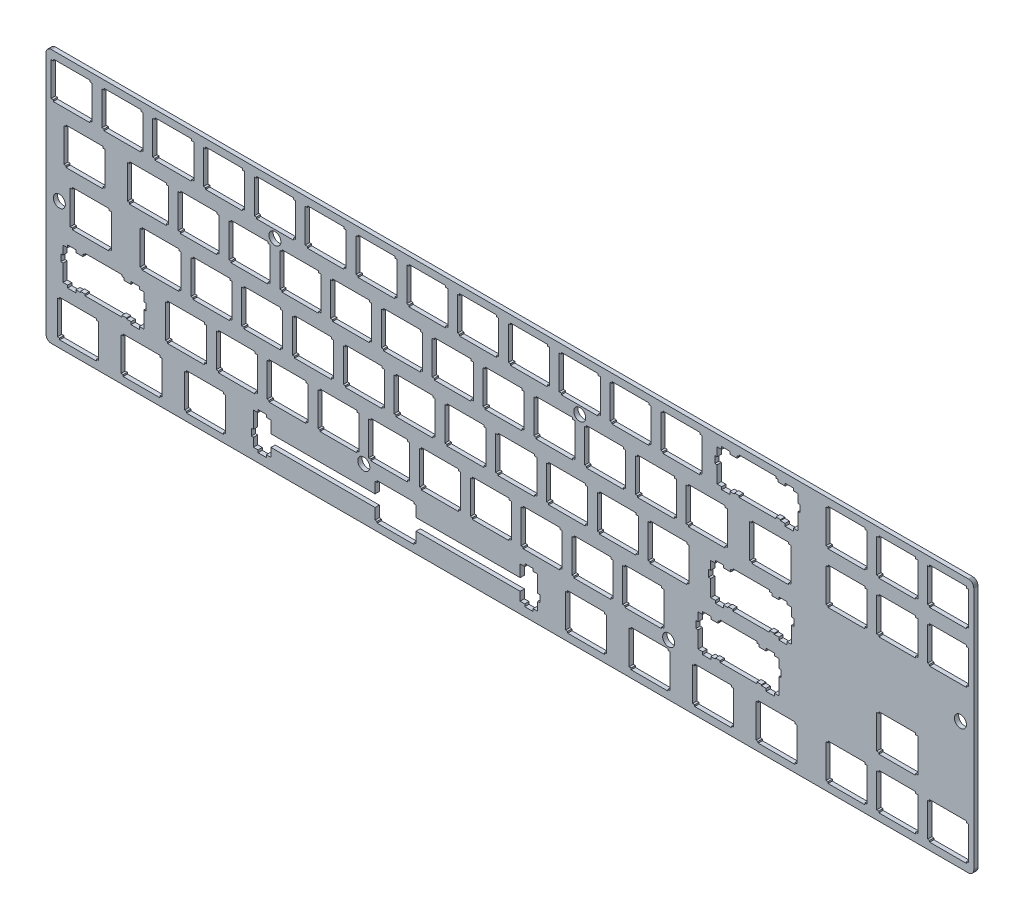
from build123d import *

# Parameters (mm, degrees)
MODEL_R             = 2.25
BOSS_EXTRUDE1_DEPTH = 1.5875


with BuildPart() as part:
    # Model → Boss-Extrude1 (new body)
    with BuildSketch(Plane.XY):
        Polygon((370.515556908, 199.863340857), (370.672556908, 199.856640857), (370.829556908, 199.838640857), (370.982556908, 199.808340857), (371.134556908, 199.765640857), (371.281556908, 199.710640857), (371.423556908, 199.645640857), (371.561556908, 199.568740857), (371.692556908, 199.481640857), (371.815556908, 199.383940857), (371.930556908, 199.277740857), (372.036556908, 199.162040857), (372.134556908, 199.039640857), (372.221556908, 198.908340857), (372.298556908, 198.770840857), (372.363556908, 198.628640857), (372.418556908, 198.482540857), (372.461556908, 198.329840857), (372.491556908, 198.176740857), (372.509556908, 198.019740857), (372.516556908, 197.862740857), (372.516556908, 106.413230857), (372.509556908, 106.256130857), (372.491556908, 106.100410857), (372.461556908, 105.946070857), (372.418556908, 105.794490857), (372.363556908, 105.647040857), (372.298556908, 105.505100857), (372.221556908, 105.368670857), (372.134556908, 105.237760857), (372.036556908, 105.113740857), (371.930556908, 104.997983857), (371.815556908, 104.891874857), (371.692556908, 104.794035857), (371.561556908, 104.707216857), (371.423556908, 104.630046857), (371.281556908, 104.565280857), (371.134556908, 104.510158857), (370.982556908, 104.467440857), (370.829556908, 104.437122857), (370.672556908, 104.419208857), (370.515556908, 104.413695857), (26.653556908, 104.413695857), (26.496456908, 104.419208857), (26.339356908, 104.437122857), (26.186396908, 104.467440857), (26.033436908, 104.510158857), (25.887366908, 104.565280857), (25.745426908, 104.630046857), (25.607616908, 104.707216857), (25.476708908, 104.794035857), (25.354061908, 104.891874857), (25.238308908, 104.997983857), (25.132199908, 105.113740857), (25.034356908, 105.237760857), (24.947541908, 105.368670857), (24.870371908, 105.505100857), (24.805603908, 105.647040857), (24.750481908, 105.794490857), (24.707762908, 105.946070857), (24.677445908, 106.100410857), (24.659531908, 106.256130857), (24.652641508, 106.411850857), (24.652641508, 197.862740857), (24.659531908, 198.019740857), (24.677445908, 198.176740857), (24.707762908, 198.329840857), (24.750481908, 198.482540857), (24.805603908, 198.628640857), (24.870371908, 198.770840857), (24.947541908, 198.908340857), (25.034356908, 199.039640857), (25.132199908, 199.162040857), (25.238308908, 199.277740857), (25.354061908, 199.383940857), (25.476708908, 199.481640857), (25.607616908, 199.568740857), (25.745426908, 199.645640857), (25.887366908, 199.710640857), (26.033436908, 199.765640857), (26.186396908, 199.808340857), (26.339356908, 199.838640857), (26.496456908, 199.856640857), (26.653556908, 199.863340857), align=None)
        with Locations((143.815056908, 123.864140857)):
            Circle(MODEL_R, mode=Mode.SUBTRACT)
        with Locations((110.477456908, 180.414140857)):
            Circle(MODEL_R, mode=Mode.SUBTRACT)
        with Locations((224.778056908, 180.414140857)):
            Circle(MODEL_R, mode=Mode.SUBTRACT)
        with Locations((258.115056908, 123.864140857)):
            Circle(MODEL_R, mode=Mode.SUBTRACT)
        Polygon((162.620556908, 107.138080857), (162.620556908, 107.737580857), (163.419556908, 107.737580857), (163.419556908, 111.838580857), (202.445456908, 111.838580857), (202.445456908, 108.608480857), (204.169556908, 108.608480857), (204.169556908, 107.689280857), (207.270056908, 107.689280857), (207.270056908, 108.608480857), (208.995556908, 108.608480857), (208.995556908, 111.838580857), (209.819556908, 111.838580857), (209.819556908, 114.438940857), (208.995556908, 114.438940857), (208.995556908, 120.707630857), (207.270056908, 120.707630857), (207.270056908, 121.688800857), (204.169556908, 121.688800857), (204.169556908, 120.707630857), (202.445456908, 120.707630857), (202.445456908, 116.238670857), (163.419556908, 116.238670857), (163.419556908, 120.338330857), (162.620556908, 120.338330857), (162.620556908, 120.939140857), (148.820556908, 120.939140857), (148.820556908, 120.338330857), (148.019556908, 120.338330857), (148.019556908, 116.238670857), (108.995556908, 116.238670857), (108.995556908, 120.707630857), (107.269556908, 120.707630857), (107.269556908, 121.688800857), (104.169556908, 121.688800857), (104.169556908, 120.707630857), (102.445556908, 120.707630857), (102.445556908, 114.438940857), (101.620556908, 114.438940857), (101.620556908, 111.838580857), (102.445556908, 111.838580857), (102.445556908, 108.608480857), (104.169556908, 108.608480857), (104.169556908, 107.689280857), (107.269556908, 107.689280857), (107.269556908, 108.608480857), (108.995556908, 108.608480857), (108.995556908, 111.838580857), (148.019556908, 111.838580857), (148.019556908, 107.737580857), (148.820556908, 107.737580857), (148.820556908, 107.138080857), align=None, mode=Mode.SUBTRACT)
        Polygon((355.989556908, 120.939140857), (355.989556908, 120.339640857), (355.190556908, 120.339640857), (355.190556908, 107.738890857), (355.989556908, 107.738890857), (355.989556908, 107.138080857), (369.790556908, 107.138080857), (369.790556908, 107.738890857), (370.589556908, 107.738890857), (370.589556908, 120.339640857), (369.790556908, 120.339640857), (369.790556908, 120.939140857), align=None, mode=Mode.SUBTRACT)
        Polygon((336.939556908, 120.939140857), (336.939556908, 120.339640857), (336.140556908, 120.339640857), (336.140556908, 107.738890857), (336.939556908, 107.738890857), (336.939556908, 107.138080857), (350.740556908, 107.138080857), (350.740556908, 107.738890857), (351.539556908, 107.738890857), (351.539556908, 120.339640857), (350.740556908, 120.339640857), (350.740556908, 120.939140857), align=None, mode=Mode.SUBTRACT)
        Polygon((317.889556908, 120.939140857), (317.889556908, 120.339640857), (317.090556908, 120.339640857), (317.090556908, 107.738890857), (317.889556908, 107.738890857), (317.889556908, 107.138080857), (331.690556908, 107.138080857), (331.690556908, 107.738890857), (332.489556908, 107.738890857), (332.489556908, 120.339640857), (331.690556908, 120.339640857), (331.690556908, 120.939140857), align=None, mode=Mode.SUBTRACT)
        Polygon((291.695556908, 120.939140857), (291.695556908, 120.339640857), (290.896556908, 120.339640857), (290.896556908, 107.738890857), (291.695556908, 107.738890857), (291.695556908, 107.138080857), (305.495556908, 107.138080857), (305.495556908, 107.738890857), (306.296556908, 107.738890857), (306.296556908, 120.339640857), (305.495556908, 120.339640857), (305.495556908, 120.939140857), align=None, mode=Mode.SUBTRACT)
        Polygon((267.884556908, 120.939140857), (267.884556908, 120.339640857), (267.084556908, 120.339640857), (267.084556908, 107.738890857), (267.884556908, 107.738890857), (267.884556908, 107.138080857), (281.684556908, 107.138080857), (281.684556908, 107.738890857), (282.483556908, 107.738890857), (282.483556908, 120.339640857), (281.684556908, 120.339640857), (281.684556908, 120.939140857), align=None, mode=Mode.SUBTRACT)
        Polygon((244.070556908, 120.939140857), (244.070556908, 120.339640857), (243.271556908, 120.339640857), (243.271556908, 107.738890857), (244.070556908, 107.738890857), (244.070556908, 107.138080857), (257.870556908, 107.138080857), (257.870556908, 107.738890857), (258.671556908, 107.738890857), (258.671556908, 120.339640857), (257.870556908, 120.339640857), (257.870556908, 120.939140857), align=None, mode=Mode.SUBTRACT)
        Polygon((220.259556908, 120.939140857), (220.259556908, 120.339640857), (219.459556908, 120.339640857), (219.459556908, 107.738890857), (220.259556908, 107.738890857), (220.259556908, 107.138080857), (234.059556908, 107.138080857), (234.059556908, 107.738890857), (234.858556908, 107.738890857), (234.858556908, 120.339640857), (234.059556908, 120.339640857), (234.059556908, 120.939140857), align=None, mode=Mode.SUBTRACT)
        Polygon((77.384656908, 120.939140857), (77.384656908, 120.339640857), (76.584156908, 120.339640857), (76.584156908, 107.738890857), (77.384656908, 107.738890857), (77.384656908, 107.138080857), (91.184256908, 107.138080857), (91.184256908, 107.738890857), (91.983656908, 107.738890857), (91.983656908, 120.339640857), (91.184256908, 120.339640857), (91.184256908, 120.939140857), align=None, mode=Mode.SUBTRACT)
        Polygon((53.570756908, 120.939140857), (53.570756908, 120.339640857), (52.771556908, 120.339640857), (52.771556908, 107.738890857), (53.570756908, 107.738890857), (53.570756908, 107.138080857), (67.370356908, 107.138080857), (67.370356908, 107.738890857), (68.171156908, 107.738890857), (68.171156908, 120.339640857), (67.370356908, 120.339640857), (67.370356908, 120.939140857), align=None, mode=Mode.SUBTRACT)
        Polygon((29.759656908, 120.939140857), (29.759656908, 120.339640857), (28.959026908, 120.339640857), (28.959026908, 107.738890857), (29.759656908, 107.738890857), (29.759656908, 107.138080857), (43.559356908, 107.138080857), (43.559356908, 107.738890857), (44.358556908, 107.738890857), (44.358556908, 120.339640857), (43.559356908, 120.339640857), (43.559356908, 120.939140857), align=None, mode=Mode.SUBTRACT)
        Polygon((277.408556908, 139.990640857), (277.408556908, 139.389840857), (276.609556908, 139.389840857), (276.609556908, 138.518740857), (275.684556908, 138.518740857), (273.959556908, 138.518740857), (273.959556908, 139.437840857), (270.858556908, 139.437840857), (270.858556908, 138.518740857), (269.134556908, 138.518740857), (269.134556908, 135.288640857), (268.308556908, 135.288640857), (268.308556908, 132.688240857), (269.134556908, 132.688240857), (269.134556908, 126.418240857), (270.858556908, 126.418240857), (270.858556908, 125.438440857), (273.959556908, 125.438440857), (273.959556908, 126.418240857), (275.684556908, 126.418240857), (275.684556908, 126.788840857), (276.609556908, 126.788840857), (277.408556908, 126.788840857), (277.408556908, 126.188040857), (291.209556908, 126.188040857), (291.209556908, 126.788840857), (292.008556908, 126.788840857), (292.934556908, 126.788840857), (292.934556908, 126.418240857), (294.658556908, 126.418240857), (294.658556908, 125.438440857), (297.759556908, 125.438440857), (297.759556908, 126.418240857), (299.484556908, 126.418240857), (299.484556908, 132.688240857), (300.308556908, 132.688240857), (300.308556908, 135.288640857), (299.484556908, 135.288640857), (299.484556908, 138.518740857), (297.759556908, 138.518740857), (297.759556908, 139.437840857), (294.658556908, 139.437840857), (294.658556908, 138.518740857), (292.934556908, 138.518740857), (292.008556908, 138.518740857), (292.008556908, 139.389840857), (291.209556908, 139.389840857), (291.209556908, 139.990640857), align=None, mode=Mode.SUBTRACT)
        Polygon((39.284656908, 139.990640857), (39.284656908, 139.389840857), (38.484056908, 139.389840857), (38.484056908, 138.518740857), (37.559356908, 138.518740857), (35.834056908, 138.518740857), (35.834056908, 139.437840857), (32.733466908, 139.437840857), (32.733466908, 138.518740857), (31.009546908, 138.518740857), (31.009546908, 135.288640857), (30.184076908, 135.288640857), (30.184076908, 132.688240857), (31.009546908, 132.688240857), (31.009546908, 126.418240857), (32.733466908, 126.418240857), (32.733466908, 125.438440857), (35.834056908, 125.438440857), (35.834056908, 126.418240857), (37.559356908, 126.418240857), (37.559356908, 126.788840857), (38.484056908, 126.788840857), (39.284656908, 126.788840857), (39.284656908, 126.188040857), (53.084356908, 126.188040857), (53.084356908, 126.788840857), (53.883556908, 126.788840857), (54.809656908, 126.788840857), (54.809656908, 126.418240857), (56.533556908, 126.418240857), (56.533556908, 125.438440857), (59.634156908, 125.438440857), (59.634156908, 126.418240857), (61.359356908, 126.418240857), (61.359356908, 132.688240857), (62.183456908, 132.688240857), (62.183456908, 135.288640857), (61.359356908, 135.288640857), (61.359356908, 138.518740857), (59.634156908, 138.518740857), (59.634156908, 139.437840857), (56.533556908, 139.437840857), (56.533556908, 138.518740857), (54.809656908, 138.518740857), (53.883556908, 138.518740857), (53.883556908, 139.389840857), (53.084356908, 139.389840857), (53.084356908, 139.990640857), align=None, mode=Mode.SUBTRACT)
        Polygon((299.153556908, 195.668840857), (300.078556908, 195.668840857), (301.803556908, 195.668840857), (301.803556908, 196.589240857), (304.902556908, 196.589240857), (304.902556908, 195.668840857), (306.628556908, 195.668840857), (306.628556908, 192.438740857), (307.453556908, 192.438740857), (307.453556908, 189.838440857), (306.628556908, 189.838440857), (306.628556908, 183.568140857), (304.902556908, 183.568140857), (304.902556908, 182.588540857), (301.803556908, 182.588540857), (301.803556908, 183.568140857), (300.078556908, 183.568140857), (300.078556908, 183.937540857), (299.153556908, 183.937540857), (298.352556908, 183.937540857), (298.352556908, 183.338140857), (284.553556908, 183.338140857), (284.553556908, 183.937540857), (283.752556908, 183.937540857), (282.827556908, 183.937540857), (282.827556908, 183.568140857), (281.102556908, 183.568140857), (281.102556908, 182.588540857), (278.003556908, 182.588540857), (278.003556908, 183.568140857), (276.278556908, 183.568140857), (276.278556908, 189.838440857), (275.452556908, 189.838440857), (275.452556908, 192.438740857), (276.278556908, 192.438740857), (276.278556908, 195.668840857), (278.003556908, 195.668840857), (278.003556908, 196.589240857), (281.102556908, 196.589240857), (281.102556908, 195.668840857), (282.827556908, 195.668840857), (283.752556908, 195.668840857), (283.752556908, 196.538440857), (284.553556908, 196.538440857), (284.553556908, 197.137740857), (298.352556908, 197.137740857), (298.352556908, 196.538440857), (299.153556908, 196.538440857), align=None, mode=Mode.SUBTRACT)
        Polygon((296.771556908, 157.568840857), (297.695556908, 157.568840857), (299.421556908, 157.568840857), (299.421556908, 158.489240857), (302.521556908, 158.489240857), (302.521556908, 157.568840857), (304.245556908, 157.568840857), (304.245556908, 154.338740857), (305.070556908, 154.338740857), (305.070556908, 151.739540857), (304.245556908, 151.739540857), (304.245556908, 145.469640857), (302.521556908, 145.469640857), (302.521556908, 144.488540857), (299.421556908, 144.488540857), (299.421556908, 145.469640857), (297.695556908, 145.469640857), (297.695556908, 145.838940857), (296.771556908, 145.838940857), (295.970556908, 145.838940857), (295.970556908, 145.239540857), (282.170556908, 145.239540857), (282.170556908, 145.838940857), (281.371556908, 145.838940857), (280.445556908, 145.838940857), (280.445556908, 145.469640857), (278.720556908, 145.469640857), (278.720556908, 144.488540857), (275.620556908, 144.488540857), (275.620556908, 145.469640857), (273.895556908, 145.469640857), (273.895556908, 151.739540857), (273.071556908, 151.739540857), (273.071556908, 154.338740857), (273.895556908, 154.338740857), (273.895556908, 157.568840857), (275.620556908, 157.568840857), (275.620556908, 158.489240857), (278.720556908, 158.489240857), (278.720556908, 157.568840857), (280.445556908, 157.568840857), (281.371556908, 157.568840857), (281.371556908, 158.438440857), (282.170556908, 158.438440857), (282.170556908, 159.039240857), (295.970556908, 159.039240857), (295.970556908, 158.438440857), (296.771556908, 158.438440857), align=None, mode=Mode.SUBTRACT)
        Polygon((336.939556908, 139.990640857), (336.939556908, 139.389840857), (336.140556908, 139.389840857), (336.140556908, 126.788840857), (336.939556908, 126.788840857), (336.939556908, 126.188040857), (350.740556908, 126.188040857), (350.740556908, 126.788840857), (351.539556908, 126.788840857), (351.539556908, 139.389840857), (350.740556908, 139.389840857), (350.740556908, 139.990640857), align=None, mode=Mode.SUBTRACT)
        Polygon((241.689556908, 139.990640857), (241.689556908, 139.389840857), (240.890556908, 139.389840857), (240.890556908, 126.788840857), (241.689556908, 126.788840857), (241.689556908, 126.188040857), (255.490556908, 126.188040857), (255.490556908, 126.788840857), (256.289556908, 126.788840857), (256.289556908, 139.389840857), (255.490556908, 139.389840857), (255.490556908, 139.990640857), align=None, mode=Mode.SUBTRACT)
        Polygon((222.639556908, 139.990640857), (222.639556908, 139.389840857), (221.840556908, 139.389840857), (221.840556908, 126.788840857), (222.639556908, 126.788840857), (222.639556908, 126.188040857), (236.440556908, 126.188040857), (236.440556908, 126.788840857), (237.239556908, 126.788840857), (237.239556908, 139.389840857), (236.440556908, 139.389840857), (236.440556908, 139.990640857), align=None, mode=Mode.SUBTRACT)
        Polygon((203.589556908, 139.990640857), (203.589556908, 139.389840857), (202.790556908, 139.389840857), (202.790556908, 126.788840857), (203.589556908, 126.788840857), (203.589556908, 126.188040857), (217.390556908, 126.188040857), (217.390556908, 126.788840857), (218.189556908, 126.788840857), (218.189556908, 139.389840857), (217.390556908, 139.389840857), (217.390556908, 139.990640857), align=None, mode=Mode.SUBTRACT)
        Polygon((184.539556908, 139.990640857), (184.539556908, 139.389840857), (183.740556908, 139.389840857), (183.740556908, 126.788840857), (184.539556908, 126.788840857), (184.539556908, 126.188040857), (198.340556908, 126.188040857), (198.340556908, 126.788840857), (199.139556908, 126.788840857), (199.139556908, 139.389840857), (198.340556908, 139.389840857), (198.340556908, 139.990640857), align=None, mode=Mode.SUBTRACT)
        Polygon((165.489556908, 139.990640857), (165.489556908, 139.389840857), (164.690556908, 139.389840857), (164.690556908, 126.788840857), (165.489556908, 126.788840857), (165.489556908, 126.188040857), (179.290556908, 126.188040857), (179.290556908, 126.788840857), (180.089556908, 126.788840857), (180.089556908, 139.389840857), (179.290556908, 139.389840857), (179.290556908, 139.990640857), align=None, mode=Mode.SUBTRACT)
        Polygon((146.439556908, 139.990640857), (146.439556908, 139.389840857), (145.640556908, 139.389840857), (145.640556908, 126.788840857), (146.439556908, 126.788840857), (146.439556908, 126.188040857), (160.240556908, 126.188040857), (160.240556908, 126.788840857), (161.039556908, 126.788840857), (161.039556908, 139.389840857), (160.240556908, 139.389840857), (160.240556908, 139.990640857), align=None, mode=Mode.SUBTRACT)
        Polygon((127.389556908, 139.990640857), (127.389556908, 139.389840857), (126.590556908, 139.389840857), (126.590556908, 126.788840857), (127.389556908, 126.788840857), (127.389556908, 126.188040857), (141.190556908, 126.188040857), (141.190556908, 126.788840857), (141.989556908, 126.788840857), (141.989556908, 139.389840857), (141.190556908, 139.389840857), (141.190556908, 139.990640857), align=None, mode=Mode.SUBTRACT)
        Polygon((108.339456908, 139.990640857), (108.339456908, 139.389840857), (107.540456908, 139.389840857), (107.540456908, 126.788840857), (108.339456908, 126.788840857), (108.339456908, 126.188040857), (122.140456908, 126.188040857), (122.140456908, 126.788840857), (122.939856908, 126.788840857), (122.939856908, 139.389840857), (122.140456908, 139.389840857), (122.140456908, 139.990640857), align=None, mode=Mode.SUBTRACT)
        Polygon((89.289456908, 139.990640857), (89.289456908, 139.389840857), (88.490456908, 139.389840857), (88.490456908, 126.788840857), (89.289456908, 126.788840857), (89.289456908, 126.188040857), (103.090456908, 126.188040857), (103.090456908, 126.788840857), (103.889856908, 126.788840857), (103.889856908, 139.389840857), (103.090456908, 139.389840857), (103.090456908, 139.990640857), align=None, mode=Mode.SUBTRACT)
        Polygon((70.239456908, 139.990640857), (70.239456908, 139.389840857), (69.440456908, 139.389840857), (69.440456908, 126.788840857), (70.239456908, 126.788840857), (70.239456908, 126.188040857), (84.040456908, 126.188040857), (84.040456908, 126.788840857), (84.839856908, 126.788840857), (84.839856908, 139.389840857), (84.040456908, 139.389840857), (84.040456908, 139.990640857), align=None, mode=Mode.SUBTRACT)
        Polygon((251.214556908, 159.039240857), (251.214556908, 158.438440857), (250.415556908, 158.438440857), (250.415556908, 145.838940857), (251.214556908, 145.838940857), (251.214556908, 145.239540857), (265.015556908, 145.239540857), (265.015556908, 145.838940857), (265.814556908, 145.838940857), (265.814556908, 158.438440857), (265.015556908, 158.438440857), (265.015556908, 159.039240857), align=None, mode=Mode.SUBTRACT)
        Polygon((232.164556908, 159.039240857), (232.164556908, 158.438440857), (231.365556908, 158.438440857), (231.365556908, 145.838940857), (232.164556908, 145.838940857), (232.164556908, 145.239540857), (245.965556908, 145.239540857), (245.965556908, 145.838940857), (246.764556908, 145.838940857), (246.764556908, 158.438440857), (245.965556908, 158.438440857), (245.965556908, 159.039240857), align=None, mode=Mode.SUBTRACT)
        Polygon((213.114556908, 159.039240857), (213.114556908, 158.438440857), (212.315556908, 158.438440857), (212.315556908, 145.838940857), (213.114556908, 145.838940857), (213.114556908, 145.239540857), (226.915556908, 145.239540857), (226.915556908, 145.838940857), (227.714556908, 145.838940857), (227.714556908, 158.438440857), (226.915556908, 158.438440857), (226.915556908, 159.039240857), align=None, mode=Mode.SUBTRACT)
        Polygon((194.064556908, 159.039240857), (194.064556908, 158.438440857), (193.265556908, 158.438440857), (193.265556908, 145.838940857), (194.064556908, 145.838940857), (194.064556908, 145.239540857), (207.865556908, 145.239540857), (207.865556908, 145.838940857), (208.664556908, 145.838940857), (208.664556908, 158.438440857), (207.865556908, 158.438440857), (207.865556908, 159.039240857), align=None, mode=Mode.SUBTRACT)
        Polygon((175.014556908, 159.039240857), (175.014556908, 158.438440857), (174.215556908, 158.438440857), (174.215556908, 145.838940857), (175.014556908, 145.838940857), (175.014556908, 145.239540857), (188.815556908, 145.239540857), (188.815556908, 145.838940857), (189.614556908, 145.838940857), (189.614556908, 158.438440857), (188.815556908, 158.438440857), (188.815556908, 159.039240857), align=None, mode=Mode.SUBTRACT)
        Polygon((155.964556908, 159.039240857), (155.964556908, 158.438440857), (155.165556908, 158.438440857), (155.165556908, 145.838940857), (155.964556908, 145.838940857), (155.964556908, 145.239540857), (169.765556908, 145.239540857), (169.765556908, 145.838940857), (170.564556908, 145.838940857), (170.564556908, 158.438440857), (169.765556908, 158.438440857), (169.765556908, 159.039240857), align=None, mode=Mode.SUBTRACT)
        Polygon((136.914556908, 159.039240857), (136.914556908, 158.438440857), (136.115556908, 158.438440857), (136.115556908, 145.838940857), (136.914556908, 145.838940857), (136.914556908, 145.239540857), (150.715556908, 145.239540857), (150.715556908, 145.838940857), (151.514556908, 145.838940857), (151.514556908, 158.438440857), (150.715556908, 158.438440857), (150.715556908, 159.039240857), align=None, mode=Mode.SUBTRACT)
        Polygon((117.864456908, 159.039240857), (117.864456908, 158.438440857), (117.065456908, 158.438440857), (117.065456908, 145.838940857), (117.864456908, 145.838940857), (117.864456908, 145.239540857), (131.665556908, 145.239540857), (131.665556908, 145.838940857), (132.464556908, 145.838940857), (132.464556908, 158.438440857), (131.665556908, 158.438440857), (131.665556908, 159.039240857), align=None, mode=Mode.SUBTRACT)
        Polygon((98.814456908, 159.039240857), (98.814456908, 158.438440857), (98.015456908, 158.438440857), (98.015456908, 145.838940857), (98.814456908, 145.838940857), (98.814456908, 145.239540857), (112.615456908, 145.239540857), (112.615456908, 145.838940857), (113.414856908, 145.838940857), (113.414856908, 158.438440857), (112.615456908, 158.438440857), (112.615456908, 159.039240857), align=None, mode=Mode.SUBTRACT)
        Polygon((79.764456908, 159.039240857), (79.764456908, 158.438440857), (78.965456908, 158.438440857), (78.965456908, 145.838940857), (79.764456908, 145.838940857), (79.764456908, 145.239540857), (93.565456908, 145.239540857), (93.565456908, 145.838940857), (94.364856908, 145.838940857), (94.364856908, 158.438440857), (93.565456908, 158.438440857), (93.565456908, 159.039240857), align=None, mode=Mode.SUBTRACT)
        Polygon((60.714456908, 159.039240857), (60.714456908, 158.438440857), (59.915456908, 158.438440857), (59.915456908, 145.838940857), (60.714456908, 145.838940857), (60.714456908, 145.239540857), (74.515456908, 145.239540857), (74.515456908, 145.838940857), (75.314856908, 145.838940857), (75.314856908, 158.438440857), (74.515456908, 158.438440857), (74.515456908, 159.039240857), align=None, mode=Mode.SUBTRACT)
        Polygon((34.520776908, 159.039240857), (34.520776908, 158.438440857), (33.721526908, 158.438440857), (33.721526908, 145.838940857), (34.520776908, 145.838940857), (34.520776908, 145.239540857), (48.320456908, 145.239540857), (48.320456908, 145.838940857), (49.121056908, 145.838940857), (49.121056908, 158.438440857), (48.320456908, 158.438440857), (48.320456908, 159.039240857), align=None, mode=Mode.SUBTRACT)
        Polygon((355.989556908, 178.087740857), (355.989556908, 177.489840857), (355.190556908, 177.489840857), (355.190556908, 164.888940857), (355.989556908, 164.888940857), (355.989556908, 164.289540857), (369.790556908, 164.289540857), (369.790556908, 164.888940857), (370.589556908, 164.888940857), (370.589556908, 177.489840857), (369.790556908, 177.489840857), (369.790556908, 178.087740857), align=None, mode=Mode.SUBTRACT)
        Polygon((336.939556908, 178.087740857), (336.939556908, 177.489840857), (336.140556908, 177.489840857), (336.140556908, 164.888940857), (336.939556908, 164.888940857), (336.939556908, 164.289540857), (350.740556908, 164.289540857), (350.740556908, 164.888940857), (351.539556908, 164.888940857), (351.539556908, 177.489840857), (350.740556908, 177.489840857), (350.740556908, 178.087740857), align=None, mode=Mode.SUBTRACT)
        Polygon((317.889556908, 178.087740857), (317.889556908, 177.489840857), (317.090556908, 177.489840857), (317.090556908, 164.888940857), (317.889556908, 164.888940857), (317.889556908, 164.289540857), (331.690556908, 164.289540857), (331.690556908, 164.888940857), (332.489556908, 164.888940857), (332.489556908, 177.489840857), (331.690556908, 177.489840857), (331.690556908, 178.087740857), align=None, mode=Mode.SUBTRACT)
        Polygon((289.314556908, 178.087740857), (289.314556908, 177.489840857), (288.515556908, 177.489840857), (288.515556908, 164.888940857), (289.314556908, 164.888940857), (289.314556908, 164.289540857), (303.115556908, 164.289540857), (303.115556908, 164.888940857), (303.914556908, 164.888940857), (303.914556908, 177.489840857), (303.115556908, 177.489840857), (303.115556908, 178.087740857), align=None, mode=Mode.SUBTRACT)
        Polygon((265.503556908, 178.087740857), (265.503556908, 177.489840857), (264.702556908, 177.489840857), (264.702556908, 164.888940857), (265.503556908, 164.888940857), (265.503556908, 164.289540857), (279.301556908, 164.289540857), (279.301556908, 164.888940857), (280.103556908, 164.888940857), (280.103556908, 177.489840857), (279.301556908, 177.489840857), (279.301556908, 178.087740857), align=None, mode=Mode.SUBTRACT)
        Polygon((246.453556908, 178.087740857), (246.453556908, 177.489840857), (245.652556908, 177.489840857), (245.652556908, 164.888940857), (246.453556908, 164.888940857), (246.453556908, 164.289540857), (260.252556908, 164.289540857), (260.252556908, 164.888940857), (261.053556908, 164.888940857), (261.053556908, 177.489840857), (260.252556908, 177.489840857), (260.252556908, 178.087740857), align=None, mode=Mode.SUBTRACT)
        Polygon((227.403556908, 178.087740857), (227.403556908, 177.489840857), (226.602556908, 177.489840857), (226.602556908, 164.888940857), (227.403556908, 164.888940857), (227.403556908, 164.289540857), (241.202556908, 164.289540857), (241.202556908, 164.888940857), (242.003556908, 164.888940857), (242.003556908, 177.489840857), (241.202556908, 177.489840857), (241.202556908, 178.087740857), align=None, mode=Mode.SUBTRACT)
        Polygon((208.353556908, 178.087740857), (208.353556908, 177.489840857), (207.552556908, 177.489840857), (207.552556908, 164.888940857), (208.353556908, 164.888940857), (208.353556908, 164.289540857), (222.152556908, 164.289540857), (222.152556908, 164.888940857), (222.953556908, 164.888940857), (222.953556908, 177.489840857), (222.152556908, 177.489840857), (222.152556908, 178.087740857), align=None, mode=Mode.SUBTRACT)
        Polygon((189.303556908, 178.087740857), (189.303556908, 177.489840857), (188.502556908, 177.489840857), (188.502556908, 164.888940857), (189.303556908, 164.888940857), (189.303556908, 164.289540857), (203.102556908, 164.289540857), (203.102556908, 164.888940857), (203.903556908, 164.888940857), (203.903556908, 177.489840857), (203.102556908, 177.489840857), (203.102556908, 178.087740857), align=None, mode=Mode.SUBTRACT)
        Polygon((170.253556908, 178.087740857), (170.253556908, 177.489840857), (169.452556908, 177.489840857), (169.452556908, 164.888940857), (170.253556908, 164.888940857), (170.253556908, 164.289540857), (184.052556908, 164.289540857), (184.052556908, 164.888940857), (184.853556908, 164.888940857), (184.853556908, 177.489840857), (184.052556908, 177.489840857), (184.052556908, 178.087740857), align=None, mode=Mode.SUBTRACT)
        Polygon((151.201556908, 178.087740857), (151.201556908, 177.489840857), (150.402556908, 177.489840857), (150.402556908, 164.888940857), (151.201556908, 164.888940857), (151.201556908, 164.289540857), (165.002556908, 164.289540857), (165.002556908, 164.888940857), (165.802556908, 164.888940857), (165.802556908, 177.489840857), (165.002556908, 177.489840857), (165.002556908, 178.087740857), align=None, mode=Mode.SUBTRACT)
        Polygon((132.151556908, 178.087740857), (132.151556908, 177.489840857), (131.351556908, 177.489840857), (131.351556908, 164.888940857), (132.151556908, 164.888940857), (132.151556908, 164.289540857), (145.952556908, 164.289540857), (145.952556908, 164.888940857), (146.753556908, 164.888940857), (146.753556908, 177.489840857), (145.952556908, 177.489840857), (145.952556908, 178.087740857), align=None, mode=Mode.SUBTRACT)
        Polygon((113.101956908, 178.087740857), (113.101956908, 177.489840857), (112.301556908, 177.489840857), (112.301556908, 164.888940857), (113.101956908, 164.888940857), (113.101956908, 164.289540857), (126.902556908, 164.289540857), (126.902556908, 164.888940857), (127.703556908, 164.888940857), (127.703556908, 177.489840857), (126.902556908, 177.489840857), (126.902556908, 178.087740857), align=None, mode=Mode.SUBTRACT)
        Polygon((94.051956908, 178.087740857), (94.051956908, 177.489840857), (93.252956908, 177.489840857), (93.252956908, 164.888940857), (94.051956908, 164.888940857), (94.051956908, 164.289540857), (107.852956908, 164.289540857), (107.852956908, 164.888940857), (108.653756908, 164.888940857), (108.653756908, 177.489840857), (107.852956908, 177.489840857), (107.852956908, 178.087740857), align=None, mode=Mode.SUBTRACT)
        Polygon((75.003356908, 178.087740857), (75.003356908, 177.489840857), (74.202956908, 177.489840857), (74.202956908, 164.888940857), (75.003356908, 164.888940857), (75.003356908, 164.289540857), (88.802956908, 164.289540857), (88.802956908, 164.888940857), (89.603756908, 164.888940857), (89.603756908, 177.489840857), (88.802956908, 177.489840857), (88.802956908, 178.087740857), align=None, mode=Mode.SUBTRACT)
        Polygon((55.953356908, 178.087740857), (55.953356908, 177.489840857), (55.152756908, 177.489840857), (55.152756908, 164.888940857), (55.953356908, 164.888940857), (55.953356908, 164.289540857), (69.752956908, 164.289540857), (69.752956908, 164.888940857), (70.553756908, 164.888940857), (70.553756908, 177.489840857), (69.752956908, 177.489840857), (69.752956908, 178.087740857), align=None, mode=Mode.SUBTRACT)
        Polygon((32.139526908, 178.087740857), (32.139526908, 177.489840857), (31.340276908, 177.489840857), (31.340276908, 164.888940857), (32.139526908, 164.888940857), (32.139526908, 164.289540857), (45.940556908, 164.289540857), (45.940556908, 164.888940857), (46.739856908, 164.888940857), (46.739856908, 177.489840857), (45.940556908, 177.489840857), (45.940556908, 178.087740857), align=None, mode=Mode.SUBTRACT)
        Polygon((355.989556908, 197.137740857), (355.989556908, 196.538440857), (355.190556908, 196.538440857), (355.190556908, 183.937540857), (355.989556908, 183.937540857), (355.989556908, 183.338140857), (369.790556908, 183.338140857), (369.790556908, 183.937540857), (370.589556908, 183.937540857), (370.589556908, 196.538440857), (369.790556908, 196.538440857), (369.790556908, 197.137740857), align=None, mode=Mode.SUBTRACT)
        Polygon((336.939556908, 197.137740857), (336.939556908, 196.538440857), (336.140556908, 196.538440857), (336.140556908, 183.937540857), (336.939556908, 183.937540857), (336.939556908, 183.338140857), (350.740556908, 183.338140857), (350.740556908, 183.937540857), (351.539556908, 183.937540857), (351.539556908, 196.538440857), (350.740556908, 196.538440857), (350.740556908, 197.137740857), align=None, mode=Mode.SUBTRACT)
        Polygon((317.889556908, 197.137740857), (317.889556908, 196.538440857), (317.090556908, 196.538440857), (317.090556908, 183.937540857), (317.889556908, 183.937540857), (317.889556908, 183.338140857), (331.690556908, 183.338140857), (331.690556908, 183.937540857), (332.489556908, 183.937540857), (332.489556908, 196.538440857), (331.690556908, 196.538440857), (331.690556908, 197.137740857), align=None, mode=Mode.SUBTRACT)
        Polygon((255.978556908, 197.137740857), (255.978556908, 196.538440857), (255.177556908, 196.538440857), (255.177556908, 183.937540857), (255.978556908, 183.937540857), (255.978556908, 183.338140857), (269.777556908, 183.338140857), (269.777556908, 183.937540857), (270.578556908, 183.937540857), (270.578556908, 196.538440857), (269.777556908, 196.538440857), (269.777556908, 197.137740857), align=None, mode=Mode.SUBTRACT)
        Polygon((236.928556908, 197.137740857), (236.928556908, 196.538440857), (236.127556908, 196.538440857), (236.127556908, 183.937540857), (236.928556908, 183.937540857), (236.928556908, 183.338140857), (250.727556908, 183.338140857), (250.727556908, 183.937540857), (251.528556908, 183.937540857), (251.528556908, 196.538440857), (250.727556908, 196.538440857), (250.727556908, 197.137740857), align=None, mode=Mode.SUBTRACT)
        Polygon((217.878556908, 197.137740857), (217.878556908, 196.538440857), (217.077556908, 196.538440857), (217.077556908, 183.937540857), (217.878556908, 183.937540857), (217.878556908, 183.338140857), (231.677556908, 183.338140857), (231.677556908, 183.937540857), (232.478556908, 183.937540857), (232.478556908, 196.538440857), (231.677556908, 196.538440857), (231.677556908, 197.137740857), align=None, mode=Mode.SUBTRACT)
        Polygon((198.828556908, 197.137740857), (198.828556908, 196.538440857), (198.027556908, 196.538440857), (198.027556908, 183.937540857), (198.828556908, 183.937540857), (198.828556908, 183.338140857), (212.627556908, 183.338140857), (212.627556908, 183.937540857), (213.428556908, 183.937540857), (213.428556908, 196.538440857), (212.627556908, 196.538440857), (212.627556908, 197.137740857), align=None, mode=Mode.SUBTRACT)
        Polygon((179.778556908, 197.137740857), (179.778556908, 196.538440857), (178.977556908, 196.538440857), (178.977556908, 183.937540857), (179.778556908, 183.937540857), (179.778556908, 183.338140857), (193.577556908, 183.338140857), (193.577556908, 183.937540857), (194.378556908, 183.937540857), (194.378556908, 196.538440857), (193.577556908, 196.538440857), (193.577556908, 197.137740857), align=None, mode=Mode.SUBTRACT)
        Polygon((160.728556908, 197.137740857), (160.728556908, 196.538440857), (159.927556908, 196.538440857), (159.927556908, 183.937540857), (160.728556908, 183.937540857), (160.728556908, 183.338140857), (174.527556908, 183.338140857), (174.527556908, 183.937540857), (175.327556908, 183.937540857), (175.327556908, 196.538440857), (174.527556908, 196.538440857), (174.527556908, 197.137740857), align=None, mode=Mode.SUBTRACT)
        Polygon((141.676556908, 197.137740857), (141.676556908, 196.538440857), (140.876556908, 196.538440857), (140.876556908, 183.937540857), (141.676556908, 183.937540857), (141.676556908, 183.338140857), (155.477556908, 183.338140857), (155.477556908, 183.937540857), (156.277556908, 183.937540857), (156.277556908, 196.538440857), (155.477556908, 196.538440857), (155.477556908, 197.137740857), align=None, mode=Mode.SUBTRACT)
        Polygon((122.626956908, 197.137740857), (122.626956908, 196.538440857), (121.826456908, 196.538440857), (121.826456908, 183.937540857), (122.626956908, 183.937540857), (122.626956908, 183.338140857), (136.426556908, 183.338140857), (136.426556908, 183.937540857), (137.227556908, 183.937540857), (137.227556908, 196.538440857), (136.426556908, 196.538440857), (136.426556908, 197.137740857), align=None, mode=Mode.SUBTRACT)
        Polygon((103.576956908, 197.137740857), (103.576956908, 196.538440857), (102.776556908, 196.538440857), (102.776556908, 183.937540857), (103.576956908, 183.937540857), (103.576956908, 183.338140857), (117.377956908, 183.338140857), (117.377956908, 183.937540857), (118.177356908, 183.937540857), (118.177356908, 196.538440857), (117.377956908, 196.538440857), (117.377956908, 197.137740857), align=None, mode=Mode.SUBTRACT)
        Polygon((84.525556908, 197.137740857), (84.525556908, 196.538440857), (83.726456908, 196.538440857), (83.726456908, 183.937540857), (84.525556908, 183.937540857), (84.525556908, 183.338140857), (98.327956908, 183.338140857), (98.327956908, 183.937540857), (99.128756908, 183.937540857), (99.128756908, 196.538440857), (98.327956908, 196.538440857), (98.327956908, 197.137740857), align=None, mode=Mode.SUBTRACT)
        Polygon((65.476956908, 197.137740857), (65.476956908, 196.538440857), (64.676456908, 196.538440857), (64.676456908, 183.937540857), (65.476956908, 183.937540857), (65.476956908, 183.338140857), (79.276556908, 183.338140857), (79.276556908, 183.937540857), (80.078756908, 183.937540857), (80.078756908, 196.538440857), (79.276556908, 196.538440857), (79.276556908, 197.137740857), align=None, mode=Mode.SUBTRACT)
        Polygon((46.428356908, 197.137740857), (46.428356908, 196.538440857), (45.626356908, 196.538440857), (45.626356908, 183.937540857), (46.428356908, 183.937540857), (46.428356908, 183.338140857), (60.226556908, 183.338140857), (60.226556908, 183.937540857), (61.028756908, 183.937540857), (61.028756908, 196.538440857), (60.226556908, 196.538440857), (60.226556908, 197.137740857), align=None, mode=Mode.SUBTRACT)
        Polygon((27.378396908, 197.137740857), (27.378396908, 196.538440857), (26.577756908, 196.538440857), (26.577756908, 183.937540857), (27.378396908, 183.937540857), (27.378396908, 183.338140857), (41.178056908, 183.338140857), (41.178056908, 183.937540857), (41.978756908, 183.937540857), (41.978756908, 196.538440857), (41.178056908, 196.538440857), (41.178056908, 197.137740857), align=None, mode=Mode.SUBTRACT)
        with BuildLine():
            ThreePointArc((367.516556908, 154.388340857), (365.266556908, 152.138340857), (367.516556908, 149.888340857))
            ThreePointArc((367.516556908, 149.888340857), (369.766556908, 152.138340857), (367.516556908, 154.388340857))
        make_face(mode=Mode.SUBTRACT)
        with BuildLine():
            ThreePointArc((29.652641508, 149.888340857), (31.902641508, 152.138340857), (29.652641508, 154.388340857))
            ThreePointArc((29.652641508, 154.388340857), (27.402641508, 152.138340857), (29.652641508, 149.888340857))
        make_face(mode=Mode.SUBTRACT)
    extrude(amount=BOSS_EXTRUDE1_DEPTH)


solid = part.part
